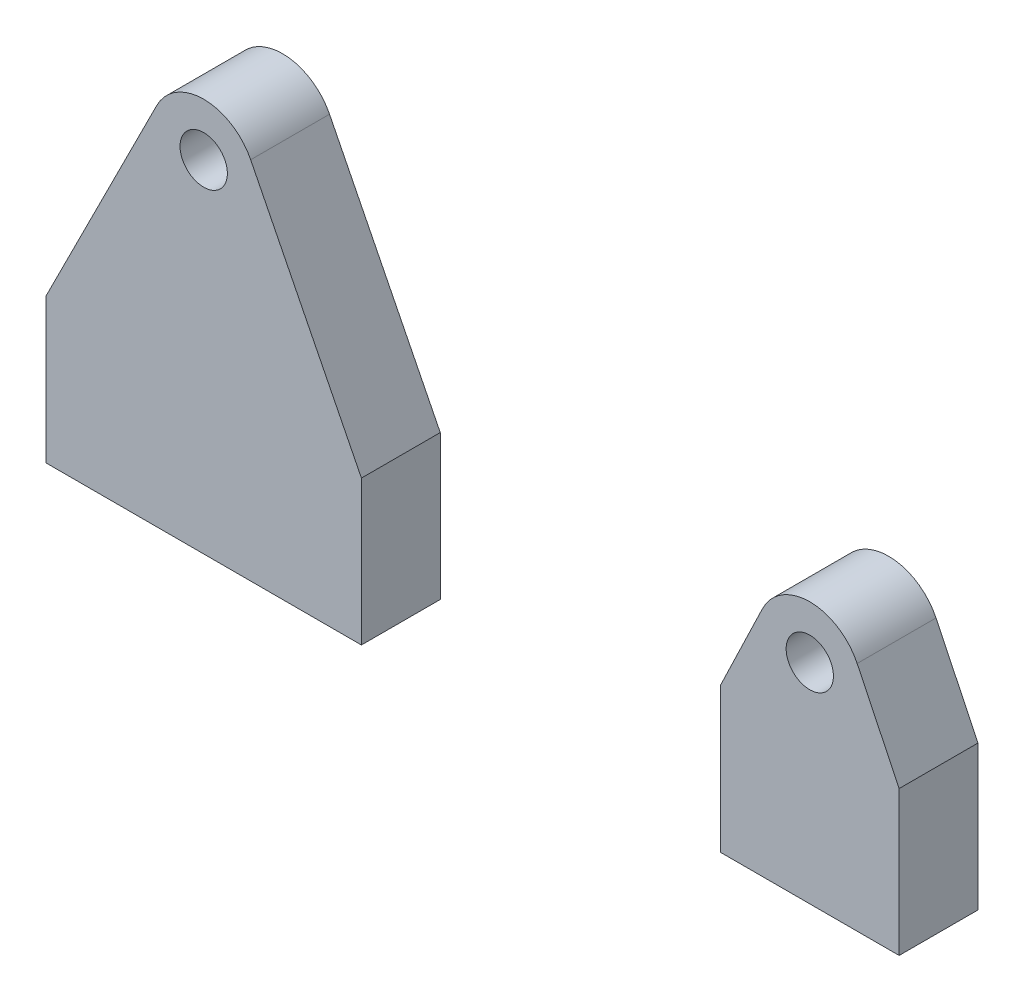
from build123d import *

# Parameters (mm, degrees)
BOSS_EXTRUDE1_DEPTH   = 15
BOSS_EXTRUDE1_2_DEPTH = 15


with BuildPart() as part:
    # Sketch3 → Boss-Extrude1 (new body)
    with BuildSketch(Plane(origin=(0, 0, -60), x_dir=(-1, 0, 0), z_dir=(0, 0, -1))):
        with BuildLine():
            Line((581.302714664, -553.340939132), (560.237628041, -511.429799574))
            ThreePointArc((560.237628041, -511.429799574), (551.302714664, -505.920603838), (542.367801286, -511.429799574))
            Line((542.367801286, -511.429799574), (521.302714664, -553.340939132))
            Line((521.302714664, -553.340939132), (521.302714664, -580.840939132))
            Line((521.302714664, -580.840939132), (581.302714664, -580.840939132))
            Line((581.302714664, -580.840939132), (581.302714664, -553.340939132))
        make_face()
        with BuildLine():
            add(Edge.make_bspline(
                [(555.699368258, -514.961730974), (553.78162253, -506.168423785), (544.98831534, -508.086169514), (546.906061069, -516.879476703), (548.823806798, -525.672783892), (557.617113987, -523.755038163), (555.699368258, -514.961730974)],
                knots=[0, 0, 0, 0, 0.5, 0.5, 0.5, 1, 1, 1, 1], degree=3, weights=[1, 0.333333333, 0.333333333, 1, 0.333333333, 0.333333333, 1]))
        make_face(mode=Mode.SUBTRACT)
    extrude(amount=BOSS_EXTRUDE1_DEPTH)


with BuildPart() as body_2:
    # Sketch3 → Boss-Extrude1 2 (new body)
    with BuildSketch(Plane(origin=(0, 0, -60), x_dir=(-1, 0, 0), z_dir=(0, 0, -1))):
        with BuildLine():
            Line((453.012687074, -553.340939132), (445.02473792, -536.730651814))
            ThreePointArc((445.02473792, -536.730651814), (436.012687074, -531.064580695), (427.000636228, -536.730651814))
            Line((427.000636228, -536.730651814), (419.012687074, -553.340939132))
            Line((419.012687074, -553.340939132), (419.012687074, -580.840939132))
            Line((419.012687074, -580.840939132), (453.012687074, -580.840939132))
            Line((453.012687074, -580.840939132), (453.012687074, -553.340939132))
        make_face()
        with BuildLine():
            add(Edge.make_bspline(
                [(440.409340668, -540.105707831), (438.49159494, -531.312400642), (429.698287751, -533.230146371), (431.616033479, -542.02345356), (433.533779208, -550.816760749), (442.327086397, -548.89901502), (440.409340668, -540.105707831)],
                knots=[0, 0, 0, 0, 0.5, 0.5, 0.5, 1, 1, 1, 1], degree=3, weights=[1, 0.333333333, 0.333333333, 1, 0.333333333, 0.333333333, 1]))
        make_face(mode=Mode.SUBTRACT)
    extrude(amount=BOSS_EXTRUDE1_2_DEPTH)


solid = Compound([part.part, body_2.part])
